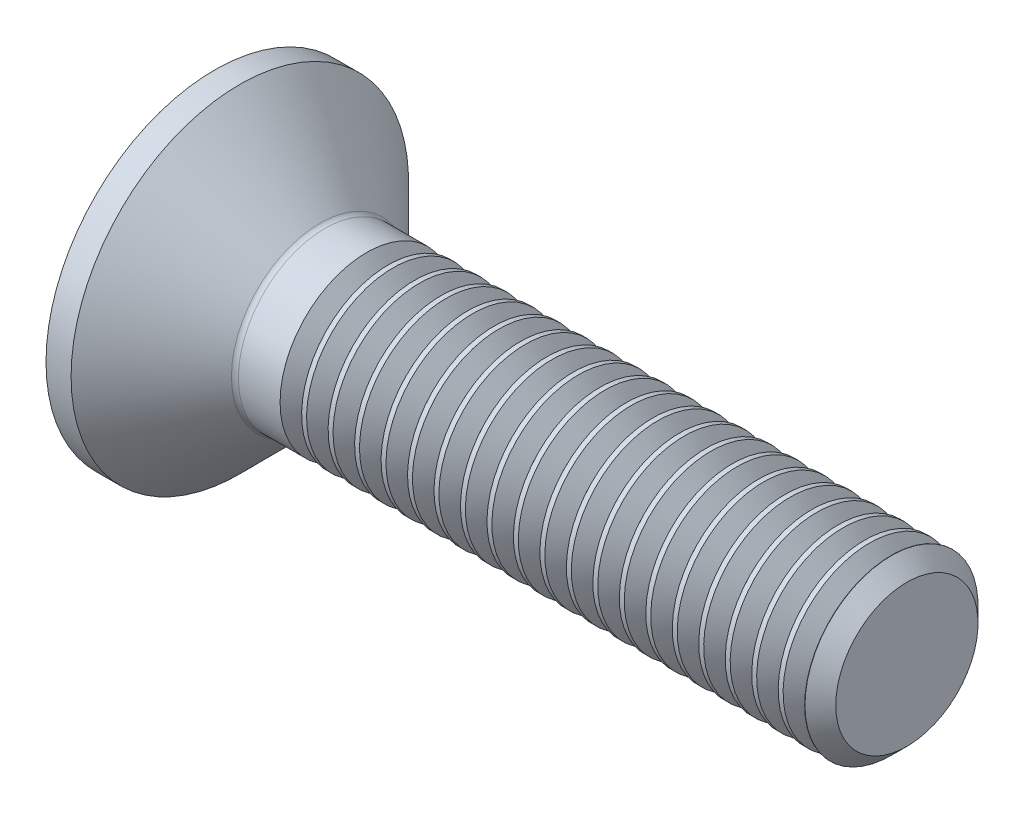
from build123d import *

# Parameters (mm, degrees)
FILLET1_R       = 0.2
HEX_START       = -1.9
HEX_2_DEPTH     = 1.9
THDSCHPAT_COUNT = 20
THDSCHPAT_PITCH = 0.765


with BuildPart() as part:
    # BodySke → BaseBody (revolve)
    with BuildSketch(Plane.XY, mode=Mode.PRIVATE) as basebody_sk:
        Polygon((0, 0), (0, 4.875), (0.725, 4.875), (3.1, 2.5), (19.555, 2.5), (20, 2.055), (20, 0), align=None)
    revolve(basebody_sk.sketch.rotate(Axis((0, 0, 0), (1, 0, 0)), 90), axis=Axis((0, 0, 0), (1, 0, 0)))

    # Fillet1
    fillet1_edges = [part.edges().sort_by_distance(p)[0] for p in [
        (3.1, 0, -2.5),
    ]]
    fillet(fillet1_edges, radius=FILLET1_R)

    # Hex 2: read off the stored shape, not the designer's step
    # Hex 2 outline → Hex 2 (cut)
    with BuildSketch(Plane.ZY.offset(HEX_START)):
        Polygon((-1.5, -0.866025404), (0, -1.732050808), (1.5, -0.866025404), (1.5, 0.866025404), (0, 1.732050808), (-1.5, 0.866025404), align=None)
    extrude(amount=HEX_2_DEPTH, mode=Mode.SUBTRACT)

    # Hex 2 2 outline → Hex 2 2 (revolve, cut)
    with BuildSketch(Plane.YX):
        Polygon((1.5, 1.9), (0, 2.766025404), (0, 1.9), align=None)
    revolve(axis=Axis((0, 0, 0), (1, 0, 0)), mode=Mode.SUBTRACT)

    # ThdSchSke → ThreadSchematic (revolve, cut)
    with BuildSketch(Plane.XY, mode=Mode.PRIVATE) as threadschematic_sk:
        Polygon((4.700001, -2.055), (4.388408645, -2.5), (4.388408645, -3.125), (5.011593355, -3.125), (5.011593355, -2.5), align=None)
    threadschematic = revolve(threadschematic_sk.sketch.rotate(Axis((-3.175, 0, 0), (1, 0, 0)), 270), axis=Axis((-3.175, 0, 0), (1, 0, 0)), mode=Mode.SUBTRACT)

    # ThdSchPat: ThreadSchematic ×20
    with Locations(*[(i * THDSCHPAT_PITCH, 0, 0) for i in range(1, THDSCHPAT_COUNT)]):
        add(threadschematic, mode=Mode.SUBTRACT)


solid = part.part
